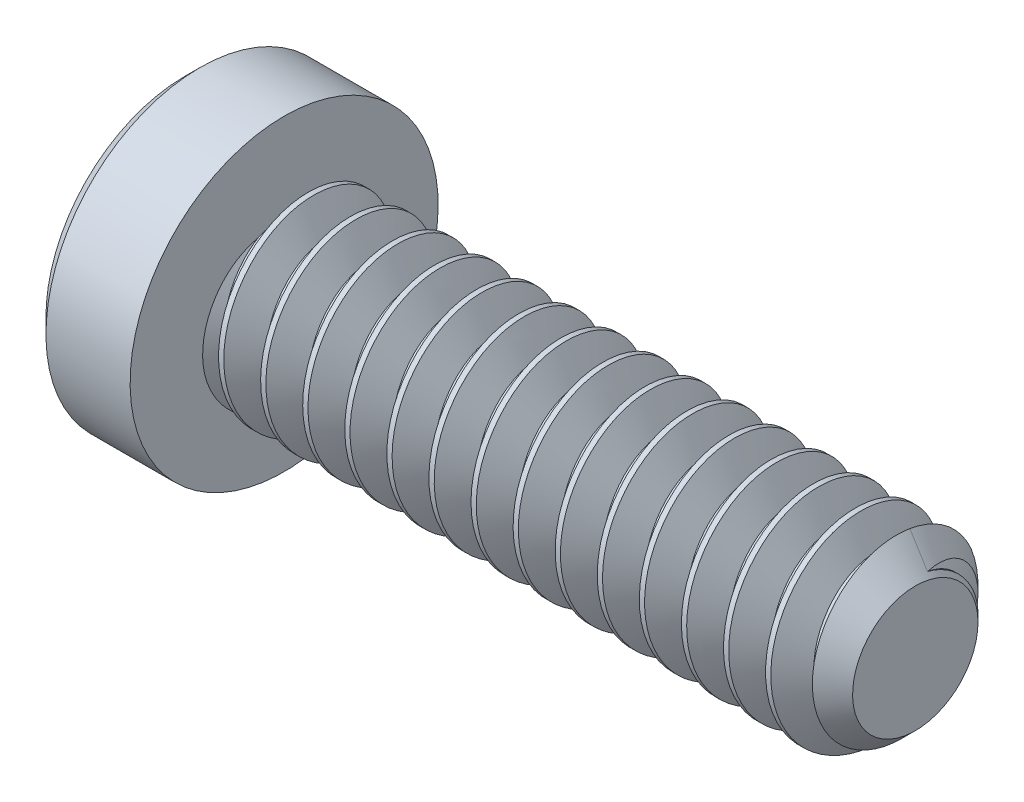
from build123d import *

# Parameters (mm, degrees)
SKETCH2_R           = 1.4224
BOSS_EXTRUDE1_DEPTH = 9.525
CHAMFER1_SIZE       = 0.47625
CUT_SWEEP1_PITCH    = 0.635
CUT_EXTRUDE1_DEPTH  = 0.9652


with BuildPart() as part:
    # Sketch2 → Boss-Extrude1 (new body)
    with BuildSketch(Plane(origin=(4.7625, 0, 0), x_dir=(0, 0, -1), z_dir=(1, 0, 0))):
        Circle(SKETCH2_R)
    extrude(amount=-BOSS_EXTRUDE1_DEPTH)

    # Chamfer1
    chamfer1_edges = [part.edges().sort_by_distance(p)[0] for p in [
        (4.7625, 0, 1.4224),
    ]]
    chamfer(chamfer1_edges, length=CHAMFER1_SIZE)

    # Cut-Sweep1: the profile of Sketch5 profile screwed along a right-hand helix of 16 turns, 6 arcs to a turn; built about Z, then put on its axis
    cut_sweep1_z = Axis((0, 0, 0), (0, 0, 1))
    cut_sweep1_corners = [(1.4227, 0, 0.277985705), (1.4227, 0, -0.277985705), (1.009955401, 0, -0.0396875), (1.009955401, 0, 0.0396875)]
    with BuildLine(mode=Mode.PRIVATE) as cut_sweep1_profile:
        Line(cut_sweep1_corners[0], cut_sweep1_corners[1])
        Line(cut_sweep1_corners[1], cut_sweep1_corners[2])
        Line(cut_sweep1_corners[2], cut_sweep1_corners[3])
        Line(cut_sweep1_corners[3], cut_sweep1_corners[0])
    cut_sweep1_cap = Face(cut_sweep1_profile.wire())
    cut_sweep1_turn_angles = [0, 30, 60, 90, 120, 150, 180, 210, 240, 270, 300, 330, 360]
    cut_sweep1_turn_weights = [1, 0.8660254037844387, 1, 0.8660254037844387, 1, 0.8660254037844387, 1, 0.8660254037844387, 1, 0.8660254037844387, 1, 0.8660254037844387, 1]
    cut_sweep1_turn_rails = [Edge.make_bspline([Vector(p[0], p[1], 0).rotate(cut_sweep1_z, cut_sweep1_turn_angles[k]) / cut_sweep1_turn_weights[k] + Vector(0, 0, p[2] + CUT_SWEEP1_PITCH * cut_sweep1_turn_angles[k] / 360) for k in range(13)], [0, 0, 0, 1, 1, 2, 2, 3, 3, 4, 4, 5, 5, 6, 6, 6], 2, cut_sweep1_turn_weights) for p in cut_sweep1_corners]
    cut_sweep1_turn_sides = [Face.make_surface_from_curves(cut_sweep1_turn_rails[p[0]], cut_sweep1_turn_rails[p[1]]) for p in [(0, 1), (1, 2), (2, 3), (3, 0)]]
    cut_sweep1 = Plane(origin=(4.7625, 0, 0), x_dir=(0, 1, 0), z_dir=(-1, 0, 0)) * Solid(Shell([*[p.moved(Location((0, 0, CUT_SWEEP1_PITCH * i))) for i in range(16) for p in cut_sweep1_turn_sides], cut_sweep1_cap, cut_sweep1_cap.rotate(cut_sweep1_z, 5760).moved(Location((0, 0, CUT_SWEEP1_PITCH * 5760 / 360)))]))
    add(cut_sweep1, mode=Mode.SUBTRACT)

    # Sketch6 → Revolve1 (revolve)
    with BuildSketch(Plane.XY, mode=Mode.PRIVATE) as revolve1_sk:
        Polygon((-6.0325, 2.3241), (-6.2611, 2.0955), (-6.2611, 0), (-4.7625, 0), (-4.7625, 2.3241), align=None)
    revolve(revolve1_sk.sketch.rotate(Axis((-4.7625, 0, 0), (-1, 0, 0)), 14.209880149), axis=Axis((-4.7625, 0, 0), (-1, 0, 0)))

    # Sketch4 → Cut-Extrude1 (cut)
    with BuildSketch(Plane(origin=(-6.2611, 0, 0), x_dir=(0, 0, -1), z_dir=(1, 0, 0))):
        Polygon((0, 0.733234842), (-0.635, 0.366617421), (-0.635, -0.366617421), (0, -0.733234842), (0.635, -0.366617421), (0.635, 0.366617421), align=None)
    extrude(amount=CUT_EXTRUDE1_DEPTH, mode=Mode.SUBTRACT)

    # Cut-Extrude2 cone 1 section (through the dimple's axis) → Cut-Extrude2 (revolve, cut)
    with BuildSketch(Plane(origin=(-6.2611, 0, 0), x_dir=(0, 0, 1), z_dir=(0, 1, 0))):
        Polygon((0, 0), (0.733234842, 0), (0, 0.733234842), align=None)
    revolve(axis=Axis((-6.2611, 0, 0), (1, 0, 0)), mode=Mode.SUBTRACT)


solid = part.part
